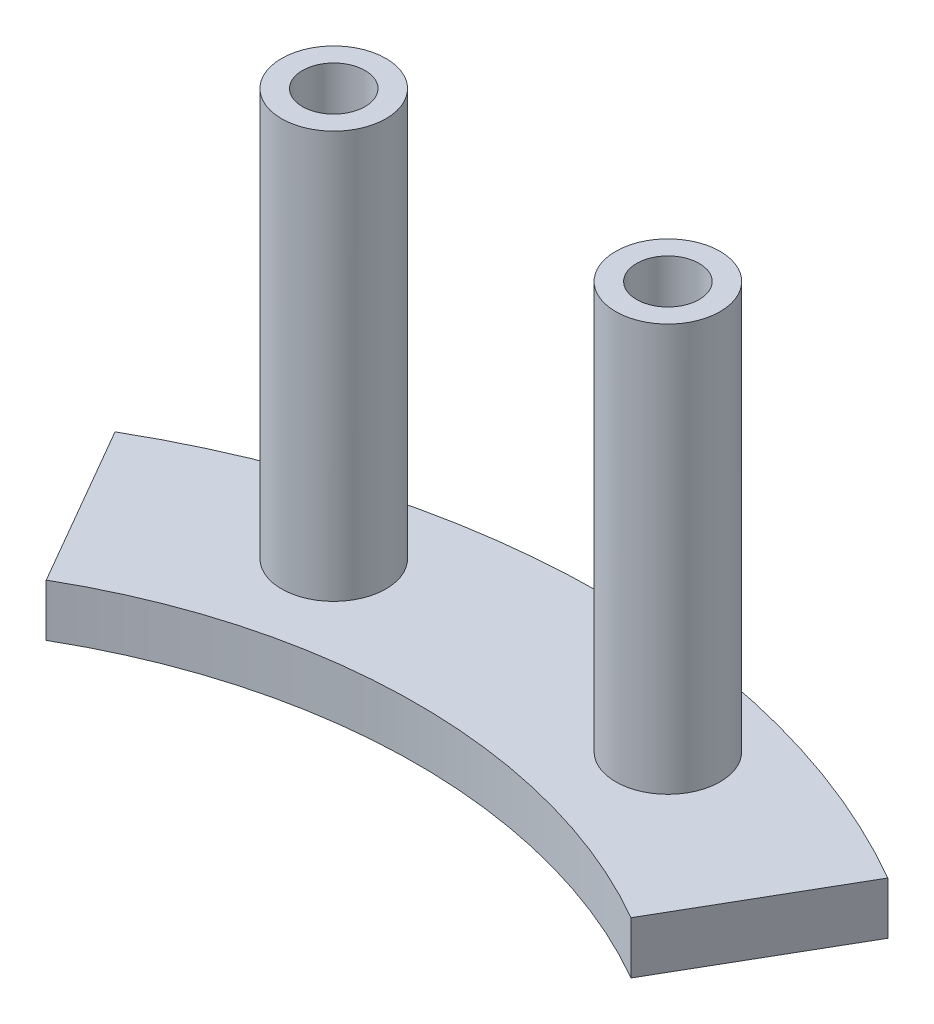
from build123d import *

# Parameters (mm, degrees)
BOSS_EXTRUDE1_DEPTH = 2.5
SKETCH2_R           = 2.5
BOSS_EXTRUDE2_DEPTH = 19.5
SKETCH5_R           = 1.5
CUT_EXTRUDE1_DEPTH  = 3.5


with BuildPart() as part:
    # Sketch1 → Boss-Extrude1 (new body)
    with BuildSketch(Plane(origin=(0, 0, 0), x_dir=(1, 0, 0), z_dir=(0, 1, 0))):
        with BuildLine():
            Line((-18.5, 32.04293994), (-14, 24.248711306))
            ThreePointArc((-14, 24.248711306), (0, 28), (14, 24.248711306))
            Line((14, 24.248711306), (18.5, 32.04293994))
            ThreePointArc((18.5, 32.04293994), (0, 37), (-18.5, 32.04293994))
        make_face()
    extrude(amount=BOSS_EXTRUDE1_DEPTH)

    # Sketch2 → Boss-Extrude2 (add)
    with BuildSketch(Plane(origin=(0, 2.5, 0), x_dir=(1, 0, 0), z_dir=(0, 1, 0))):
        with Locations((-8, 32.015621187)):
            Circle(SKETCH2_R)
        with Locations((8, 32.015621187)):
            Circle(SKETCH2_R)
    extrude(amount=BOSS_EXTRUDE2_DEPTH)

    # Sketch5 → Cut-Extrude1 (cut)
    with BuildSketch(Plane(origin=(0, 22, 0), x_dir=(1, 0, 0), z_dir=(0, 1, 0))):
        with Locations((-8, 32.015621187)):
            Circle(SKETCH5_R)
        with Locations((8, 32.015621187)):
            Circle(SKETCH5_R)
    extrude(amount=-CUT_EXTRUDE1_DEPTH, mode=Mode.SUBTRACT)


solid = part.part
